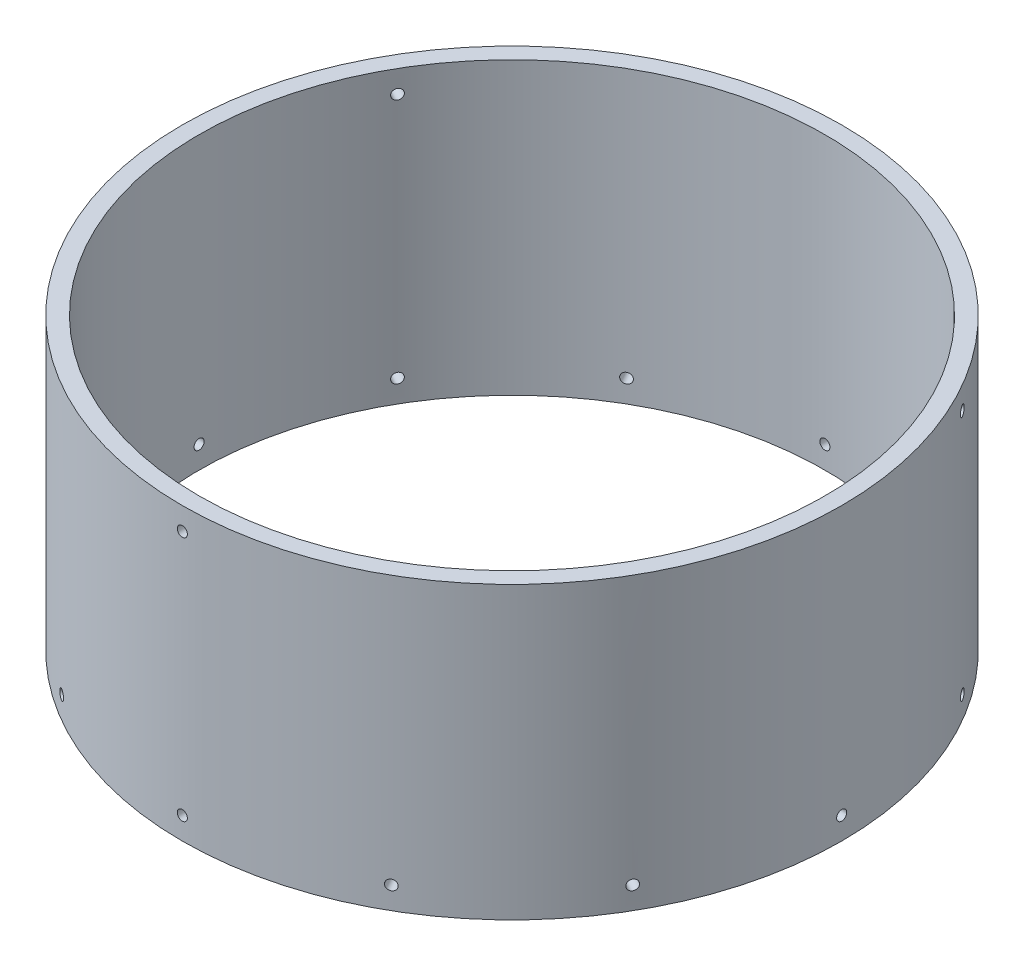
from build123d import *

# Parameters (mm, degrees)
SKETCH1_R           = 93.6625
SKETCH1_R_2         = 88.9
BOSS_EXTRUDE1_DEPTH = 41.275
SKETCH2_R           = 1.4351
CUT_EXTRUDE1_DEPTH  = 25.146
CIRPATTERN1_COUNT   = 12
SKETCH3_R           = 1.4351
CUT_EXTRUDE2_DEPTH  = 25.908
CIRPATTERN2_COUNT   = 3


with BuildPart() as part:
    # Sketch1 → Boss-Extrude1 (new, symmetric)
    with BuildSketch(Plane(origin=(0, 0, 0), x_dir=(1, 0, 0), z_dir=(0, 1, 0))):
        Circle(SKETCH1_R)
        Circle(SKETCH1_R_2, mode=Mode.SUBTRACT)
    extrude(amount=BOSS_EXTRUDE1_DEPTH, both=True)

    # Sketch2 → Cut-Extrude1 (cut)
    with BuildSketch(Plane.XY.offset(93.6625)):
        with Locations((0, -34.925)):
            Circle(SKETCH2_R)
    cut_extrude1 = extrude(amount=-CUT_EXTRUDE1_DEPTH, mode=Mode.SUBTRACT)

    # CirPattern1: Cut-Extrude1 ×12 about axis
    cirpattern1_axis = Axis((0, 41.275, 0), (0, -1, 0))
    for i in range(1, CIRPATTERN1_COUNT):
        add(cut_extrude1.rotate(cirpattern1_axis, i * 360 / CIRPATTERN1_COUNT), mode=Mode.SUBTRACT)

    # Sketch3 → Cut-Extrude2 (cut)
    with BuildSketch(Plane.XY.offset(93.6625)):
        with Locations((0, 34.925)):
            Circle(SKETCH3_R)
    cut_extrude2 = extrude(amount=-CUT_EXTRUDE2_DEPTH, mode=Mode.SUBTRACT)

    # CirPattern2: Cut-Extrude2 ×3 about axis
    cirpattern2_axis = Axis((0, 41.275, 0), (0, -1, 0))
    for i in range(1, CIRPATTERN2_COUNT):
        add(cut_extrude2.rotate(cirpattern2_axis, i * 360 / CIRPATTERN2_COUNT), mode=Mode.SUBTRACT)


solid = part.part
